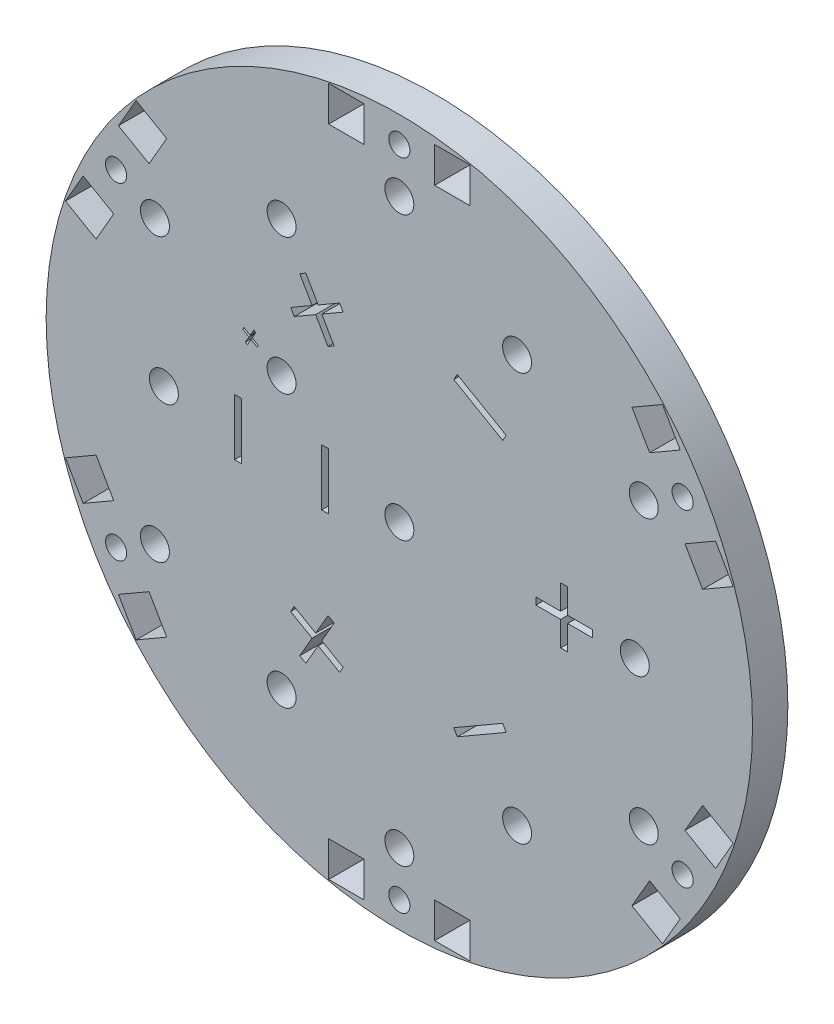
from build123d import *

# Parameters (mm, degrees)
BOSS_EXTRU_1_OUTLINE_R   = 50
BOSS_EXTRU_1_OUTLINE_W   = 5
BOSS_EXTRU_1_OUTLINE_H   = 5
BOSS_EXTRU_1_OUTLINE_R_2 = 2.05
BOSS_EXTRU_1_OUTLINE_R_3 = 1.5
BOSS_EXTRU_1_DEPTH       = 5
SKETCH3_W                = 1
SKETCH3_H                = 8
CUT_EXTRUDE2_DEPTH       = 10


# Read off the part's stored shape, not the designer's step: Boss.-Extru.1
with BuildPart() as part:
    # Boss.-Extru.1 outline → Boss.-Extru.1 (new body)
    with BuildSketch(Plane.XY):
        Circle(BOSS_EXTRU_1_OUTLINE_R)
        Polygon((-37.262039705, -33.060254038), (-39.762039705, -28.730127019), (-35.431912686, -26.230127019), (-32.931912686, -30.560254038), align=None, mode=Mode.SUBTRACT)
        with Locations((-7.5, -46.3)):
            Rectangle(BOSS_EXTRU_1_OUTLINE_W, BOSS_EXTRU_1_OUTLINE_H, mode=Mode.SUBTRACT)
        with Locations((-16.666666667, -28.867513459)):
            Circle(BOSS_EXTRU_1_OUTLINE_R_2, mode=Mode.SUBTRACT)
        with Locations((-40.096976195, -23.15)):
            Circle(BOSS_EXTRU_1_OUTLINE_R_3, mode=Mode.SUBTRACT)
        Polygon((-42.931912686, -13.239745962), (-40.431912686, -17.569872981), (-44.762039705, -20.069872981), (-47.262039705, -15.739745962), align=None, mode=Mode.SUBTRACT)
        with Locations((-34.597845014, -19.975075132)):
            Circle(BOSS_EXTRU_1_OUTLINE_R_2, mode=Mode.SUBTRACT)
        with Locations((0, -46.3)):
            Circle(BOSS_EXTRU_1_OUTLINE_R_3, mode=Mode.SUBTRACT)
        with Locations((7.5, -46.3)):
            Rectangle(BOSS_EXTRU_1_OUTLINE_W, BOSS_EXTRU_1_OUTLINE_H, mode=Mode.SUBTRACT)
        with Locations((0, -39.950150265)):
            Circle(BOSS_EXTRU_1_OUTLINE_R_2, mode=Mode.SUBTRACT)
        with Locations((16.666666667, -28.867513459)):
            Circle(BOSS_EXTRU_1_OUTLINE_R_2, mode=Mode.SUBTRACT)
        Polygon((32.931912686, -30.560254038), (35.431912686, -26.230127019), (39.762039705, -28.730127019), (37.262039705, -33.060254038), align=None, mode=Mode.SUBTRACT)
        with Locations((34.597845014, -19.975075132)):
            Circle(BOSS_EXTRU_1_OUTLINE_R_2, mode=Mode.SUBTRACT)
        with Locations((40.096976195, -23.15)):
            Circle(BOSS_EXTRU_1_OUTLINE_R_3, mode=Mode.SUBTRACT)
        Polygon((47.262039705, -15.739745962), (44.762039705, -20.069872981), (40.431912686, -17.569872981), (42.931912686, -13.239745962), align=None, mode=Mode.SUBTRACT)
        with Locations((-33.333333333, 0)):
            Circle(BOSS_EXTRU_1_OUTLINE_R_2, mode=Mode.SUBTRACT)
        Polygon((-47.262039705, 15.739745962), (-44.762039705, 20.069872981), (-40.431912686, 17.569872981), (-42.931912686, 13.239745962), align=None, mode=Mode.SUBTRACT)
        with Locations((-40.096976195, 23.15)):
            Circle(BOSS_EXTRU_1_OUTLINE_R_3, mode=Mode.SUBTRACT)
        with Locations((-34.597845014, 19.975075132)):
            Circle(BOSS_EXTRU_1_OUTLINE_R_2, mode=Mode.SUBTRACT)
        with Locations((-16.671397032, 9.625235564)):
            Circle(BOSS_EXTRU_1_OUTLINE_R_2, mode=Mode.SUBTRACT)
        Polygon((-32.931912686, 30.560254038), (-35.431912686, 26.230127019), (-39.762039705, 28.730127019), (-37.262039705, 33.060254038), align=None, mode=Mode.SUBTRACT)
        with Locations((-16.666666667, 28.867513459)):
            Circle(BOSS_EXTRU_1_OUTLINE_R_2, mode=Mode.SUBTRACT)
        with Locations((-7.5, 46.3)):
            Rectangle(BOSS_EXTRU_1_OUTLINE_W, BOSS_EXTRU_1_OUTLINE_H, mode=Mode.SUBTRACT)
        Circle(BOSS_EXTRU_1_OUTLINE_R_2, mode=Mode.SUBTRACT)
        with Locations((33.333333333, 0)):
            Circle(BOSS_EXTRU_1_OUTLINE_R_2, mode=Mode.SUBTRACT)
        with Locations((34.597845014, 19.975075133)):
            Circle(BOSS_EXTRU_1_OUTLINE_R_2, mode=Mode.SUBTRACT)
        Polygon((42.931912686, 13.239745962), (40.431912686, 17.569872981), (44.762039705, 20.069872981), (47.262039705, 15.739745962), align=None, mode=Mode.SUBTRACT)
        with Locations((40.096976195, 23.15)):
            Circle(BOSS_EXTRU_1_OUTLINE_R_3, mode=Mode.SUBTRACT)
        with Locations((16.666666667, 28.867513459)):
            Circle(BOSS_EXTRU_1_OUTLINE_R_2, mode=Mode.SUBTRACT)
        with Locations((0, 39.950150265)):
            Circle(BOSS_EXTRU_1_OUTLINE_R_2, mode=Mode.SUBTRACT)
        with Locations((0, 46.3)):
            Circle(BOSS_EXTRU_1_OUTLINE_R_3, mode=Mode.SUBTRACT)
        with Locations((7.5, 46.3)):
            Rectangle(BOSS_EXTRU_1_OUTLINE_W, BOSS_EXTRU_1_OUTLINE_H, mode=Mode.SUBTRACT)
        Polygon((37.262039705, 33.060254038), (39.762039705, 28.730127019), (35.431912686, 26.230127019), (32.931912686, 30.560254038), align=None, mode=Mode.SUBTRACT)
    extrude(amount=BOSS_EXTRU_1_DEPTH)

    # Sketch3 → Cut-Extrude2 (cut)
    with BuildSketch(Plane.XY.offset(5)):
        with Locations((-10.5, 0)):
            Rectangle(SKETCH3_W, SKETCH3_H)
        with Locations((-22.833333333, 0)):
            Rectangle(SKETCH3_W, SKETCH3_H)
        Polygon((-13.233653965, 23.921361037), (-14.099679369, 23.421361037), (-12.349679369, 20.390272124), (-15.380768282, 18.640272124), (-14.880768282, 17.77424672), (-11.849679369, 19.52424672), (-10.099679369, 16.493157806), (-9.233653965, 16.993157806), (-10.983653965, 20.02424672), (-7.952565052, 21.77424672), (-8.452565052, 22.640272124), (-11.483653965, 20.890272124), align=None)
        Polygon((15.130768282, 18.207259422), (14.630768282, 17.341234018), (7.702565052, 21.341234018), (8.202565052, 22.207259422), align=None)
        Polygon((8.202565052, -22.207259422), (7.702565052, -21.341234018), (14.630768282, -17.341234018), (15.130768282, -18.207259422), align=None)
        Polygon((27.333333333, -0.5), (27.333333333, 0.5), (23.833333333, 0.5), (23.833333333, 4), (22.833333333, 4), (22.833333333, 0.5), (19.333333333, 0.5), (19.333333333, -0.5), (22.833333333, -0.5), (22.833333333, -4), (23.833333333, -4), (23.833333333, -0.5), align=None)
        Polygon((-14.099679369, -23.421361037), (-13.233653965, -23.921361037), (-11.483653965, -20.890272124), (-8.452565052, -22.640272124), (-7.952565052, -21.77424672), (-10.983653965, -20.02424672), (-9.233653965, -16.993157806), (-10.099679369, -16.493157806), (-11.849679369, -19.52424672), (-14.880768282, -17.77424672), (-15.380768282, -18.640272124), (-12.349679369, -20.390272124), align=None)
        Polygon((-20.834234776, 12.184801987), (-19.940304487, 11.668776346), (-20.102964744, 11.386925384), (-20.996895032, 11.902951025), (-21.517828526, 11.000607275), (-21.800380609, 11.163968654), (-21.279447115, 12.066312404), (-22.173377404, 12.582338045), (-22.010717147, 12.864189006), (-21.116786859, 12.348163365), (-20.596554487, 13.24840375), (-20.314002404, 13.085042371), align=None)
    extrude(amount=-CUT_EXTRUDE2_DEPTH, mode=Mode.SUBTRACT)


solid = part.part
